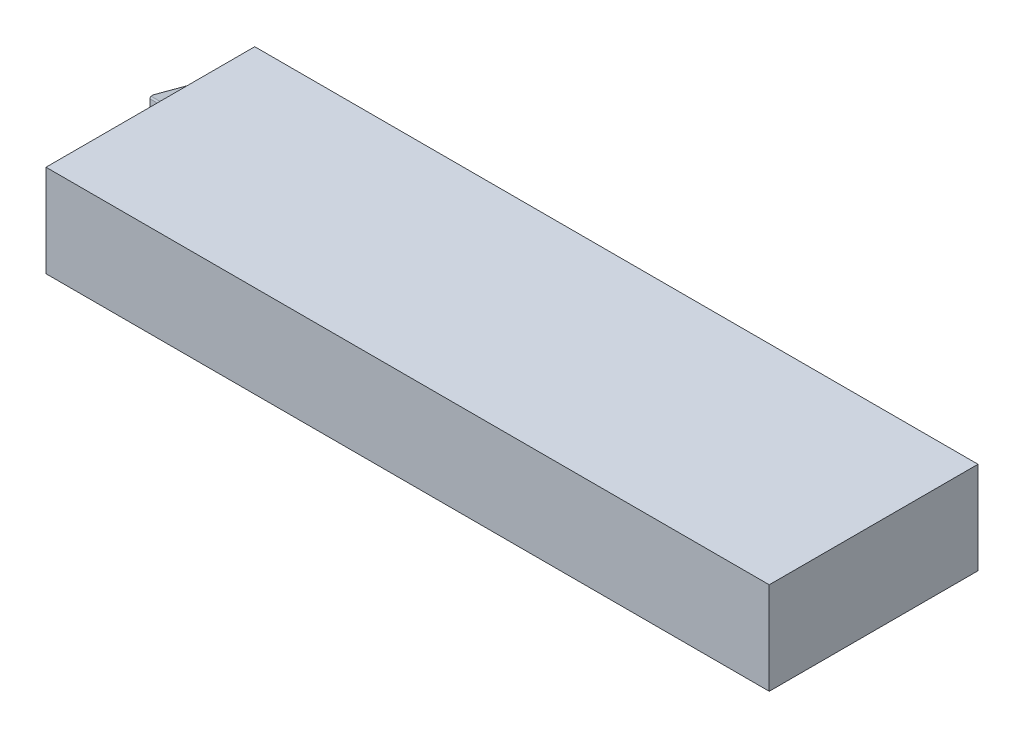
from build123d import *

# Parameters (mm, degrees)
CROQUIS1_W              = 22
CROQUIS1_H              = 6.35
SALIENTE_EXTRUIR1_DEPTH = 2.8067
SALIENTE_EXTRUIR2_DEPTH = 1.07696
SALIENTE_EXTRUIR2_TAPER = 3
REDONDEO1_R             = 0.049609375
CORTAR_EXTRUIR1_DEPTH   = 13.798873245


with BuildPart() as part:
    # Croquis1 → Saliente-Extruir1 (new body)
    with BuildSketch(Plane(origin=(0, 0, 0), x_dir=(1, 0, 0), z_dir=(0, 1, 0))):
        Rectangle(CROQUIS1_W, CROQUIS1_H)
    extrude(amount=SALIENTE_EXTRUIR1_DEPTH)

    # Croquis2 → Saliente-Extruir2 (add)
    with BuildSketch(Plane.ZY.offset(11)):
        Polygon((-0.993589744, 2.063091923), (-1.25, 2.063091923), (-1.25, 0.748989359), (-0.993589744, 0.748989359), (-0.993589744, 1.293861154), (1.25, 1.293861154), (1.25, 1.518220128), (-0.993589744, 1.518220128), align=None)
    extrude(amount=SALIENTE_EXTRUIR2_DEPTH, taper=SALIENTE_EXTRUIR2_TAPER)

    # Chaflán1: read off the stored shape, not the designer's step
    # Chaflán1: loft between two sections, ruled curve by curve
    chafl_n1_from = [
        Edge.make_line((-12.07696, 2.007207586, -1.194115663), (-12.07696, 0.804873696, -1.194115663)),
        Edge.make_line((-12.07696, 0.804873696, -1.194115663), (-12.07696, 0.804873696, -1.049474081)),
        Edge.make_line((-12.07696, 2.007207586, -1.194115663), (-12.07696, 2.007207586, -1.049474081)),
        Edge.make_line((-12.07696, 0.804873696, -1.049474081), (-12.07696, 1.349745491, -1.049474081)),
        Edge.make_line((-12.07696, 2.007207586, -1.049474081), (-12.07696, 1.462335791, -1.049474081)),
        Edge.make_line((-12.07696, 1.349745491, -1.049474081), (-12.07696, 1.349745491, 1.194115663)),
        Edge.make_line((-12.07696, 1.462335791, -1.049474081), (-12.07696, 1.462335791, 1.194115663)),
        Edge.make_line((-12.07696, 1.349745491, 1.194115663), (-12.07696, 1.462335791, 1.194115663)),
    ]
    chafl_n1_to = [
        Edge.make_line((-11, 2.628990732, -1.815898809), (-11, 0.18309055, -1.815898809)),
        Edge.make_line((-11, 0.18309055, -1.815898809), (-11, 0.18309055, -0.427690935)),
        Edge.make_line((-11, 2.628990732, -1.815898809), (-11, 2.628990732, -0.427690935)),
        Edge.make_line((-11, 0.18309055, -0.427690935), (-11, 0.727962345, -0.427690935)),
        Edge.make_line((-11, 2.628990732, -0.427690935), (-11, 2.084118937, -0.427690935)),
        Edge.make_line((-11, 0.727962345, -0.427690935), (-11, 0.727962345, 1.815898809)),
        Edge.make_line((-11, 2.084118937, -0.427690935), (-11, 2.084118937, 1.815898809)),
        Edge.make_line((-11, 0.727962345, 1.815898809), (-11, 2.084118937, 1.815898809)),
    ]
    chafl_n1 = Solid(Shell([*[Face.make_surface_from_curves(chafl_n1_from[k], chafl_n1_to[k]) for k in range(8)], Face(Wire(chafl_n1_from)), Face(Wire(chafl_n1_to))]))
    add(chafl_n1)

    # Redondeo1
    redondeo1_edges = [part.edges().sort_by_distance(p)[0] for p in [
        (-11.53848, 0.493982123, -1.505007236),
        (-11.53848, 2.318099159, -1.505007236),
        (-11.53848, 0.493982123, -0.738582508),
        (-11.53848, 2.318099159, -0.738582508),
        (-11.53848, 1.038853918, -0.738582508),
        (-11.53848, 1.773227364, -0.738582508),
        (-11.53848, 1.038853918, 1.505007236),
        (-11.53848, 1.773227364, 1.505007236),
    ]]
    fillet(redondeo1_edges, radius=REDONDEO1_R)

    # Croquis5 → Cortar-Extruir1 (cut, through all)
    with BuildSketch(Plane.XZ):
        with BuildLine():
            Line((-12.07696, -1.194115663), (-12.07696, 1.194115663))
            ThreePointArc((-12.07696, 1.194115663), (-11.963672899, 0), (-12.07696, -1.194115663))
        make_face()
    extrude(amount=-CORTAR_EXTRUIR1_DEPTH, mode=Mode.SUBTRACT)


solid = part.part
